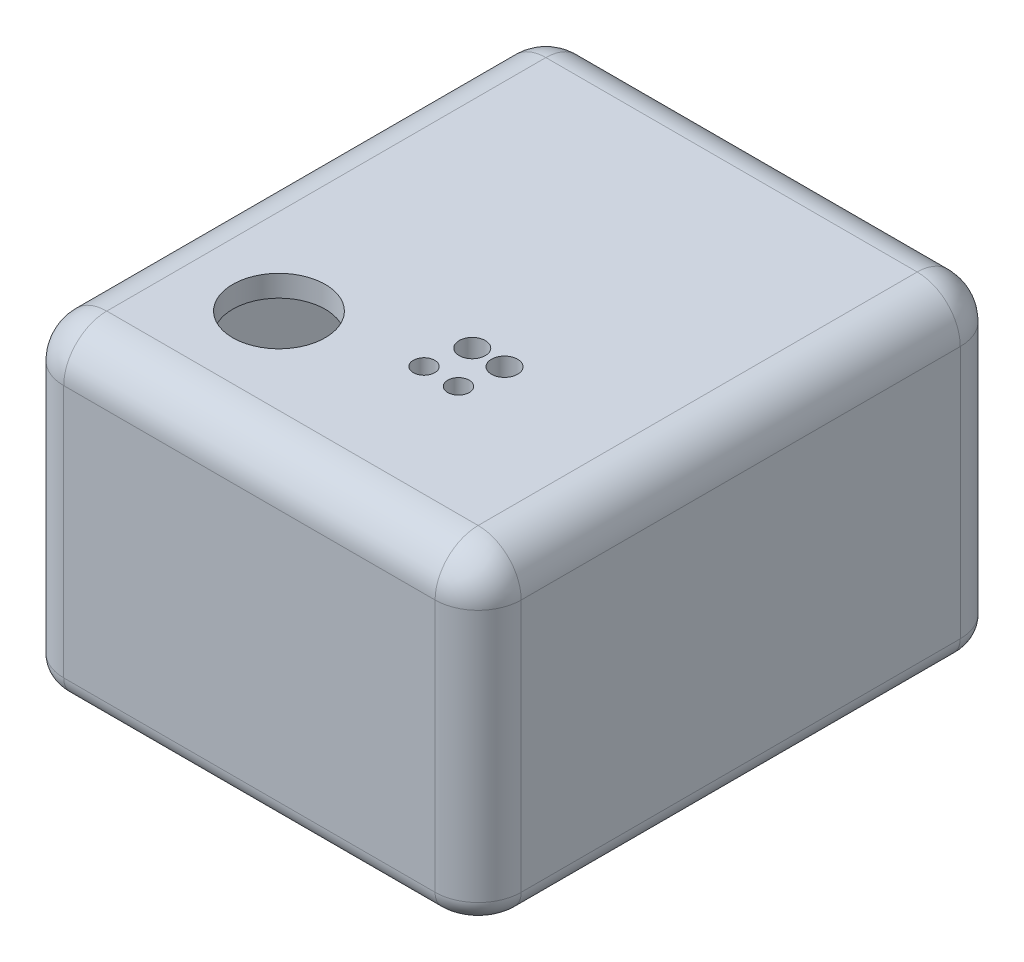
from build123d import *

# Parameters (mm, degrees)
SKETCH1_W                       = 106.27
SKETCH1_H                       = 122
BOSS_EXTRUDE1_DEPTH             = 73.8
SKETCH2_W                       = 86.27
SKETCH2_H                       = 102
CUT_EXTRUDE1_DEPTH              = 68.8
FILLET1_R                       = 10
FILLET2_R                       = 10
FILLET3_R                       = 7.5
FILLET4_R                       = 7.5
FILLET6_R                       = 5
SKETCH3_R                       = 3.04
CUT_EXTRUDE2_DEPTH              = 5
SKETCH4_R                       = 10.75
CUT_EXTRUDE3_DEPTH              = 5
SKETCH5_R                       = 2.5
CUT_EXTRUDE4_DEPTH              = 5
F_4_40_TAPPED_HOLE3_D           = 2.2606
F_4_40_TAPPED_HOLE3_DEPTH       = 30
F_4_40_TAPPED_HOLE3_CSINK_D     = 4.1148
F_4_40_TAPPED_HOLE3_CSINK_ANGLE = 100
F_4_40_TAPPED_HOLE3_TIP         = 0.679152758
F_4_40_TAPPED_HOLE4_D           = 2.2606
F_4_40_TAPPED_HOLE4_DEPTH       = 30
F_4_40_TAPPED_HOLE4_CSINK_D     = 4.1148
F_4_40_TAPPED_HOLE4_CSINK_ANGLE = 100
F_4_40_TAPPED_HOLE4_TIP         = 0.679152758


with BuildPart() as part:
    # Sketch1 → Boss-Extrude1 (new body)
    with BuildSketch(Plane(origin=(0, 0, 0), x_dir=(1, 0, 0), z_dir=(0, 1, 0))):
        Rectangle(SKETCH1_W, SKETCH1_H)
    extrude(amount=BOSS_EXTRUDE1_DEPTH)

    # Sketch2 → Cut-Extrude1 (cut)
    with BuildSketch(Plane.XZ):
        Rectangle(SKETCH2_W, SKETCH2_H)
    extrude(amount=-CUT_EXTRUDE1_DEPTH, mode=Mode.SUBTRACT)

    # Fillet1
    fillet1_edges = [part.edges().sort_by_distance(p)[0] for p in [
        (-53.135, 73.8, 0),
        (0, 73.8, 61),
        (53.135, 73.8, 0),
        (0, 73.8, -61),
    ]]
    fillet(fillet1_edges, radius=FILLET1_R)

    # Fillet2
    # the kernel refuses this fillet: 10 mm, written as the material it takes off along each edge
    with BuildSketch(Plane(origin=(43.135, 63.8, 51), x_dir=(1, 0, 0), z_dir=(0, 0, 1))) as fillet2_piece_1_section:
        Polygon((0, 0), (FILLET2_R, 0), (FILLET2_R, FILLET2_R), (0, FILLET2_R), align=None)
    fillet2_piece_1 = extrude(amount=FILLET2_R, mode=Mode.PRIVATE)
    fillet2_piece_1 = fillet2_piece_1 - Plane(origin=(43.135, 63.8, 51), x_dir=(-0.7071067811865475, -0.7071067811865475, 0), z_dir=(0, 0, 1)) * Sphere(FILLET2_R, mode=Mode.PRIVATE)
    add(fillet2_piece_1, mode=Mode.SUBTRACT)
    with BuildSketch(Plane(origin=(-43.135, 63.8, 51), x_dir=(-1, 0, 0), z_dir=(0, 0, 1))) as fillet2_piece_2_section:
        Polygon((0, 0), (FILLET2_R, 0), (FILLET2_R, -FILLET2_R), (0, -FILLET2_R), align=None)
    fillet2_piece_2 = extrude(amount=FILLET2_R, mode=Mode.PRIVATE)
    fillet2_piece_2 = fillet2_piece_2 - Plane(origin=(-43.135, 63.8, 51), x_dir=(0.7071067811865475, -0.7071067811865475, 0), z_dir=(0, 0, 1)) * Sphere(FILLET2_R, mode=Mode.PRIVATE)
    add(fillet2_piece_2, mode=Mode.SUBTRACT)
    with BuildSketch(Plane(origin=(43.135, 63.8, -51), x_dir=(0, 0, -1), z_dir=(1, 0, 0))) as fillet2_piece_3_section:
        Polygon((0, 0), (FILLET2_R, 0), (FILLET2_R, FILLET2_R), (0, FILLET2_R), align=None)
    fillet2_piece_3 = extrude(amount=FILLET2_R, mode=Mode.PRIVATE)
    fillet2_piece_3 = fillet2_piece_3 - Plane(origin=(43.135, 63.8, -51), x_dir=(0, -0.7071067811865475, 0.7071067811865475), z_dir=(1, 0, 0)) * Sphere(FILLET2_R, mode=Mode.PRIVATE)
    add(fillet2_piece_3, mode=Mode.SUBTRACT)
    with BuildSketch(Plane(origin=(-43.135, 63.8, -51), x_dir=(0, 0, -1), z_dir=(-1, 0, 0))) as fillet2_piece_4_section:
        Polygon((0, 0), (FILLET2_R, 0), (FILLET2_R, -FILLET2_R), (0, -FILLET2_R), align=None)
    fillet2_piece_4 = extrude(amount=FILLET2_R, mode=Mode.PRIVATE)
    fillet2_piece_4 = fillet2_piece_4 - Plane(origin=(-43.135, 63.8, -51), x_dir=(0, -0.7071067811865475, 0.7071067811865475), z_dir=(-1, 0, 0)) * Sphere(FILLET2_R, mode=Mode.PRIVATE)
    add(fillet2_piece_4, mode=Mode.SUBTRACT)
    with BuildSketch(Plane(origin=(-53.135, -25, -61), x_dir=(0, 0, 1), z_dir=(0, 1, 0)), Plane(origin=(-53.135, -25, 61), x_dir=(1, 0, 0), z_dir=(0, 1, 0))) as fillet2_piece_5:
        with BuildLine():
            CenterArc((FILLET2_R, FILLET2_R), FILLET2_R, 180, 90)
            Line((0, FILLET2_R), (0, 0))
            Line((0, 0), (FILLET2_R, 0))
        make_face()
    extrude(amount=88.8, mode=Mode.SUBTRACT)
    with BuildSketch(Plane(origin=(53.135, -25, -61), x_dir=(0, 0, 1), z_dir=(0, 1, 0)), Plane(origin=(53.135, -25, 61), x_dir=(-1, 0, 0), z_dir=(0, 1, 0))) as fillet2_piece_6:
        with BuildLine():
            CenterArc((FILLET2_R, -FILLET2_R), FILLET2_R, 90, 90)
            Line((0, -FILLET2_R), (0, 0))
            Line((0, 0), (FILLET2_R, 0))
        make_face()
    extrude(amount=88.8, mode=Mode.SUBTRACT)

    # Fillet3
    fillet3_edges = [part.edges().sort_by_distance(p)[0] for p in [
        (43.135, 68.8, 0),
        (0, 68.8, -51),
        (-43.135, 68.8, 0),
        (0, 68.8, 51),
    ]]
    fillet(fillet3_edges, radius=FILLET3_R)

    # Fillet4
    # the kernel refuses this fillet: 7.5 mm, written as the material it adds along each edge
    with BuildSketch(Plane(origin=(-35.635, 61.3, -43.5), x_dir=(0, 0, -1), z_dir=(-1, 0, 0))) as fillet4_piece_1_section:
        Polygon((0, 0), (FILLET4_R, 0), (FILLET4_R, -FILLET4_R), (0, -FILLET4_R), align=None)
    fillet4_piece_1 = extrude(amount=FILLET4_R, mode=Mode.PRIVATE)
    fillet4_piece_1 = fillet4_piece_1 - Plane(origin=(-35.635, 61.3, -43.5), x_dir=(0, -0.7071067811865475, 0.7071067811865475), z_dir=(-1, 0, 0)) * Sphere(FILLET4_R, mode=Mode.PRIVATE)
    add(fillet4_piece_1)
    with BuildSketch(Plane(origin=(-35.635, 61.3, 43.5), x_dir=(0, 0, 1), z_dir=(-1, 0, 0))) as fillet4_piece_2_section:
        Polygon((0, 0), (FILLET4_R, 0), (FILLET4_R, FILLET4_R), (0, FILLET4_R), align=None)
    fillet4_piece_2 = extrude(amount=FILLET4_R, mode=Mode.PRIVATE)
    fillet4_piece_2 = fillet4_piece_2 - Plane(origin=(-35.635, 61.3, 43.5), x_dir=(0, -0.7071067811865475, -0.7071067811865475), z_dir=(-1, 0, 0)) * Sphere(FILLET4_R, mode=Mode.PRIVATE)
    add(fillet4_piece_2)
    with BuildSketch(Plane(origin=(35.635, 61.3, -43.5), x_dir=(1, 0, 0), z_dir=(0, 0, -1))) as fillet4_piece_3_section:
        Polygon((0, 0), (FILLET4_R, 0), (FILLET4_R, -FILLET4_R), (0, -FILLET4_R), align=None)
    fillet4_piece_3 = extrude(amount=FILLET4_R, mode=Mode.PRIVATE)
    fillet4_piece_3 = fillet4_piece_3 - Plane(origin=(35.635, 61.3, -43.5), x_dir=(-0.7071067811865475, -0.7071067811865475, 0), z_dir=(0, 0, -1)) * Sphere(FILLET4_R, mode=Mode.PRIVATE)
    add(fillet4_piece_3)
    with BuildSketch(Plane(origin=(35.635, 61.3, 43.5), x_dir=(1, 0, 0), z_dir=(0, 0, 1))) as fillet4_piece_4_section:
        Polygon((0, 0), (FILLET4_R, 0), (FILLET4_R, FILLET4_R), (0, FILLET4_R), align=None)
    fillet4_piece_4 = extrude(amount=FILLET4_R, mode=Mode.PRIVATE)
    fillet4_piece_4 = fillet4_piece_4 - Plane(origin=(35.635, 61.3, 43.5), x_dir=(-0.7071067811865475, -0.7071067811865475, 0), z_dir=(0, 0, 1)) * Sphere(FILLET4_R, mode=Mode.PRIVATE)
    add(fillet4_piece_4)
    with BuildSketch(Plane(origin=(43.135, 0, 51), x_dir=(-1, 0, 0), z_dir=(0, 1, 0)), Plane(origin=(-43.135, 0, 51), x_dir=(0, 0, -1), z_dir=(0, 1, 0))) as fillet4_piece_5:
        with BuildLine():
            CenterArc((FILLET4_R, -FILLET4_R), FILLET4_R, 90, 90)
            Line((0, -FILLET4_R), (0, 0))
            Line((0, 0), (FILLET4_R, 0))
        make_face()
    extrude(amount=61.3)
    with BuildSketch(Plane(origin=(43.135, 0, -51), x_dir=(-1, 0, 0), z_dir=(0, 1, 0)), Plane(origin=(-43.135, 0, -51), x_dir=(0, 0, 1), z_dir=(0, 1, 0))) as fillet4_piece_6:
        with BuildLine():
            CenterArc((FILLET4_R, FILLET4_R), FILLET4_R, 180, 90)
            Line((0, FILLET4_R), (0, 0))
            Line((0, 0), (FILLET4_R, 0))
        make_face()
    extrude(amount=61.3)

    # Fillet6
    fillet6_edges = [part.edges().sort_by_distance(p)[0] for p in [
        (-53.135, 0, 0),
        (53.135, 0, 0),
        (0, 0, 61),
        (0, 0, -61),
        (-50.206067812, 0, 58.071067812),
        (50.206067812, 0, 58.071067812),
        (50.206067812, 0, -58.071067812),
        (-50.206067812, 0, -58.071067812),
    ]]
    fillet(fillet6_edges, radius=FILLET6_R)

    # Sketch3 → Cut-Extrude2 (cut)
    with BuildSketch(Plane(origin=(0, 73.8, 0), x_dir=(1, 0, 0), z_dir=(0, 1, 0))):
        with Locations(Location((14.265, -16, 0), (0, 0, 270))):
            Circle(SKETCH3_R)
        with Locations(Location((6.765, -16, 0), (0, 0, 270))):
            Circle(SKETCH3_R)
    extrude(amount=-CUT_EXTRUDE2_DEPTH, mode=Mode.SUBTRACT)

    # Sketch4 → Cut-Extrude3 (cut)
    with BuildSketch(Plane(origin=(0, 73.8, 0), x_dir=(1, 0, 0), z_dir=(0, 1, 0))):
        with Locations(Location((-23.135, -31, 0), (0, 0, 270))):
            Circle(SKETCH4_R)
    extrude(amount=-CUT_EXTRUDE3_DEPTH, mode=Mode.SUBTRACT)

    # Sketch5 → Cut-Extrude4 (cut)
    with BuildSketch(Plane(origin=(0, 73.8, 0), x_dir=(1, 0, 0), z_dir=(0, 1, 0))):
        with Locations(Location((4.865, -25.3, 0), (0, 0, 270))):
            Circle(SKETCH5_R)
        with Locations(Location((12.865, -25.3, 0), (0, 0, 270))):
            Circle(SKETCH5_R)
    extrude(amount=-CUT_EXTRUDE4_DEPTH, mode=Mode.SUBTRACT)

    # #4-40 Tapped Hole3
    with Locations(Plane(origin=(100.412065725, -2, -32.702388863), x_dir=(-1, 0, 0), z_dir=(0, -1, 0))):
        with Locations((143.547065725, -83.702388863)):
            CounterSinkHole(F_4_40_TAPPED_HOLE3_D / 2, F_4_40_TAPPED_HOLE3_CSINK_D / 2, depth=F_4_40_TAPPED_HOLE3_DEPTH, counter_sink_angle=F_4_40_TAPPED_HOLE3_CSINK_ANGLE)
            with Locations((0, 0, -(F_4_40_TAPPED_HOLE3_DEPTH + F_4_40_TAPPED_HOLE3_TIP / 2))):  # 118° drill point
                Cone(0, F_4_40_TAPPED_HOLE3_D / 2, F_4_40_TAPPED_HOLE3_TIP, mode=Mode.SUBTRACT)

    # #4-40 Tapped Hole4
    with Locations(Plane(origin=(100.412065725, -2, -32.702388863), x_dir=(-1, 0, 0), z_dir=(0, -1, 0))):
        with Locations((57.277065725, 18.297611137)):
            CounterSinkHole(F_4_40_TAPPED_HOLE4_D / 2, F_4_40_TAPPED_HOLE4_CSINK_D / 2, depth=F_4_40_TAPPED_HOLE4_DEPTH, counter_sink_angle=F_4_40_TAPPED_HOLE4_CSINK_ANGLE)
            with Locations((0, 0, -(F_4_40_TAPPED_HOLE4_DEPTH + F_4_40_TAPPED_HOLE4_TIP / 2))):  # 118° drill point
                Cone(0, F_4_40_TAPPED_HOLE4_D / 2, F_4_40_TAPPED_HOLE4_TIP, mode=Mode.SUBTRACT)


solid = part.part
